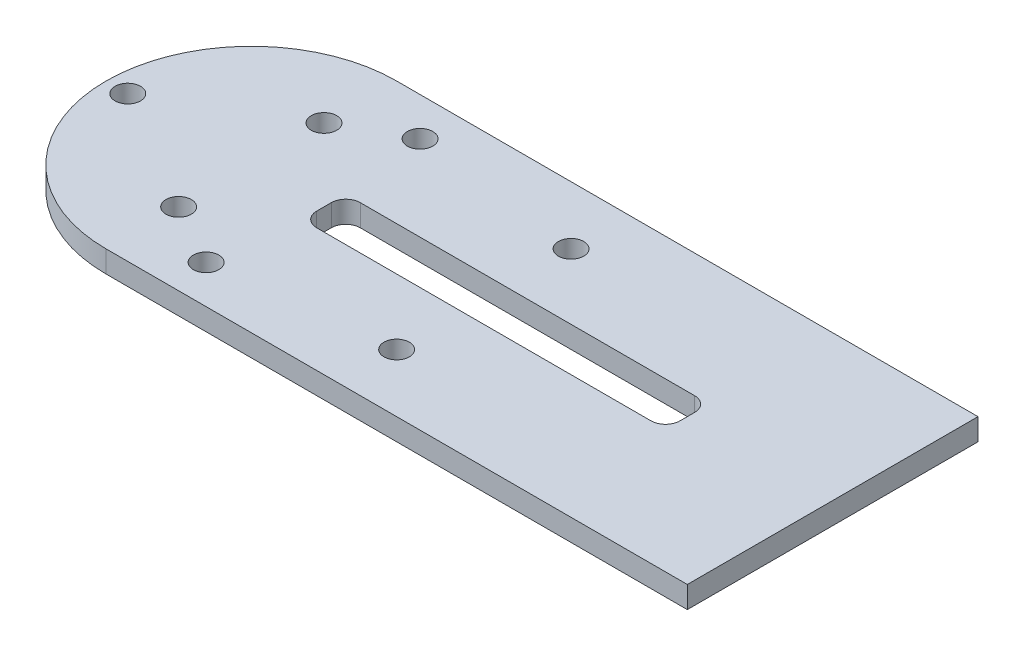
from build123d import *

# Parameters (mm, degrees)
BOSS_EXTRUDE1_DEPTH = 3
SKETCH3_R           = 1.75
CUT_EXTRUDE1_DEPTH  = 54.935146241
CUT_EXTRUDE2_REACH  = 55.935
SKETCH4_W           = 50
SKETCH4_H           = 6
FILLET1_R           = 2
CUT_EXTRUDE3_REACH  = 55.935
SKETCH5_R           = 1.75
CUT_EXTRUDE4_REACH  = 55.935
SKETCH7_R           = 1.75


with BuildPart() as part:
    # Sketch1 → Boss-Extrude1 (new body)
    with BuildSketch(Plane(origin=(0, 0, 0), x_dir=(1, 0, 0), z_dir=(0, 1, 0))):
        with BuildLine():
            Line((50, -20), (-30, -20))
            ThreePointArc((-30, -20), (-50, 0), (-30, 20))
            Line((-30, 20), (50, 20))
            Line((50, 20), (50, -20))
        make_face()
    extrude(amount=BOSS_EXTRUDE1_DEPTH)

    # Sketch3 → Cut-Extrude1 (cut, through all)
    with BuildSketch(Plane(origin=(0, 3, 0), x_dir=(1, 0, 0), z_dir=(0, 1, 0))):
        with Locations((-30, 10)):
            Circle(SKETCH3_R)
        with Locations((-30, -10)):
            Circle(SKETCH3_R)
    extrude(amount=-CUT_EXTRUDE1_DEPTH, mode=Mode.SUBTRACT)

    # Sketch4 → Cut-Extrude2 (cut, up to next)
    with BuildSketch(Plane.XZ, mode=Mode.PRIVATE) as cut_extrude2_sk1:
        with Locations((5, 0)):
            Rectangle(SKETCH4_W, SKETCH4_H)
    cut_extrude2_tool1 = extrude(cut_extrude2_sk1.sketch, amount=-CUT_EXTRUDE2_REACH, mode=Mode.PRIVATE) & part.part
    add(cut_extrude2_tool1.solids().sort_by_distance((5, 0, 0))[0], mode=Mode.SUBTRACT)

    # Fillet1
    fillet1_edges = [part.edges().sort_by_distance(p)[0] for p in [
        (-20, 1.5, -3),
        (-20, 1.5, 3),
        (30, 1.5, -3),
        (30, 1.5, 3),
    ]]
    fillet(fillet1_edges, radius=FILLET1_R)

    # Sketch5 → Cut-Extrude3 (cut, up to next)
    with BuildSketch(Plane.XZ, mode=Mode.PRIVATE) as cut_extrude3_sk1:
        with Locations((-21.5, -14.722431864)):
            Circle(SKETCH5_R)
    cut_extrude3_tool1 = extrude(cut_extrude3_sk1.sketch, amount=-CUT_EXTRUDE3_REACH, mode=Mode.PRIVATE) & part.part
    # Sketch5 → Cut-Extrude3 (cut, up to next)
    with BuildSketch(Plane.XZ, mode=Mode.PRIVATE) as cut_extrude3_sk2:
        with Locations((-21.5, 14.722431864)):
            Circle(SKETCH5_R)
    cut_extrude3_tool2 = extrude(cut_extrude3_sk2.sketch, amount=-CUT_EXTRUDE3_REACH, mode=Mode.PRIVATE) & part.part
    # Sketch5 → Cut-Extrude3 (cut, up to next)
    with BuildSketch(Plane.XZ, mode=Mode.PRIVATE) as cut_extrude3_sk3:
        with Locations((-47, 0)):
            Circle(SKETCH5_R)
    cut_extrude3_tool3 = extrude(cut_extrude3_sk3.sketch, amount=-CUT_EXTRUDE3_REACH, mode=Mode.PRIVATE) & part.part
    add(cut_extrude3_tool1.solids().sort_by_distance((-21.5, 0, -14.722432))[0], mode=Mode.SUBTRACT)
    add(cut_extrude3_tool2.solids().sort_by_distance((-21.5, 0, 14.722432))[0], mode=Mode.SUBTRACT)
    add(cut_extrude3_tool3.solids().sort_by_distance((-47, 0, 0))[0], mode=Mode.SUBTRACT)

    # Sketch7 → Cut-Extrude4 (cut, up to next)
    with BuildSketch(Plane.XZ, mode=Mode.PRIVATE) as cut_extrude4_sk1:
        with Locations((2, 12)):
            Circle(SKETCH7_R)
    cut_extrude4_tool1 = extrude(cut_extrude4_sk1.sketch, amount=-CUT_EXTRUDE4_REACH, mode=Mode.PRIVATE) & part.part
    # Sketch7 → Cut-Extrude4 (cut, up to next)
    with BuildSketch(Plane.XZ, mode=Mode.PRIVATE) as cut_extrude4_sk2:
        with Locations((2, -12)):
            Circle(SKETCH7_R)
    cut_extrude4_tool2 = extrude(cut_extrude4_sk2.sketch, amount=-CUT_EXTRUDE4_REACH, mode=Mode.PRIVATE) & part.part
    add(cut_extrude4_tool1.solids().sort_by_distance((2, 0, 12))[0], mode=Mode.SUBTRACT)
    add(cut_extrude4_tool2.solids().sort_by_distance((2, 0, -12))[0], mode=Mode.SUBTRACT)


solid = part.part
